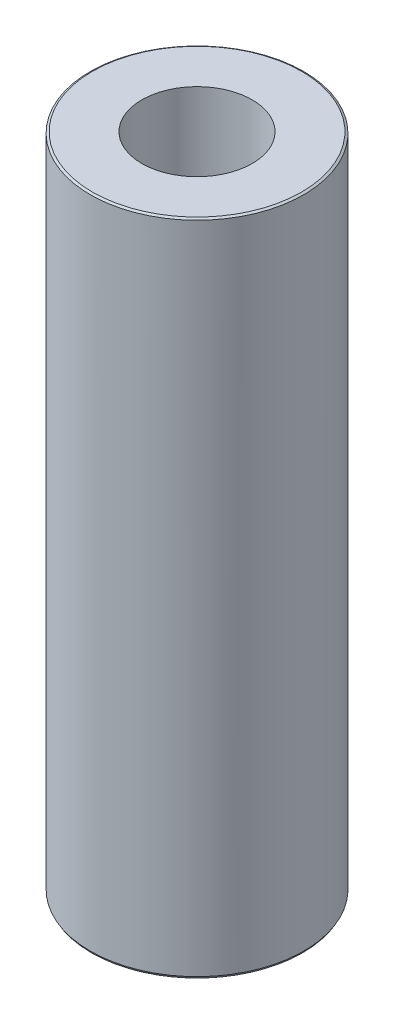
from build123d import *
from OCP.BRepFilletAPI import BRepFilletAPI_MakeChamfer

# Parameters (mm, degrees)
SKETCH1_R           = 20
BOSS_EXTRUDE1_DEPTH = 123.356648218
SKETCH2_R           = 10.344905635
CUT_EXTRUDE1_DEPTH  = 127.557744368
CHAMFER1_SIZE       = 0.231129899
CHAMFER1_SIZE2      = 0.400328729


with BuildPart() as part:
    # Sketch1 → Boss-Extrude1 (new body)
    with BuildSketch(Plane(origin=(0, 0, 0), x_dir=(1, 0, 0), z_dir=(0, 1, 0))):
        Circle(SKETCH1_R)
    extrude(amount=BOSS_EXTRUDE1_DEPTH)

    # Sketch2 → Cut-Extrude1 (cut, through all)
    with BuildSketch(Plane(origin=(0, 0, 0), x_dir=(1, 0, 0), z_dir=(0, 1, 0))):
        Circle(SKETCH2_R)
    extrude(amount=CUT_EXTRUDE1_DEPTH, mode=Mode.SUBTRACT)

    # Chamfer1: one chamfer whose edges measure the first distance from different faces: ONE call of the kernel's chamfer builder (chamfer() names one face for all edges)
    chamfer1_edges_1 = [part.edges().sort_by_distance(p)[0] for p in [
        (-20, 123.356648218, 0),
    ]]
    chamfer1_side_1 = [part.faces().sort_by_distance(p)[0] for p in [
        (-20, 61.678324109, 0),
    ]]
    chamfer1_edges_2 = [part.edges().sort_by_distance(p)[0] for p in [
        (-20, 0, 0),
    ]]
    chamfer1_side_2 = [part.faces().sort_by_distance(p)[0] for p in [
        (-19.434314575, 0, 0),
    ]]
    chamfer1 = BRepFilletAPI_MakeChamfer(part.part.solid().wrapped)
    for e in chamfer1_edges_1:
        chamfer1.Add(CHAMFER1_SIZE, CHAMFER1_SIZE2, e.wrapped, chamfer1_side_1[0].wrapped)  # the first distance lies on this face
    for e in chamfer1_edges_2:
        chamfer1.Add(CHAMFER1_SIZE, CHAMFER1_SIZE2, e.wrapped, chamfer1_side_2[0].wrapped)  # the first distance lies on this face
    add(Compound.cast(chamfer1.Shape()), mode=Mode.REPLACE)


solid = part.part
